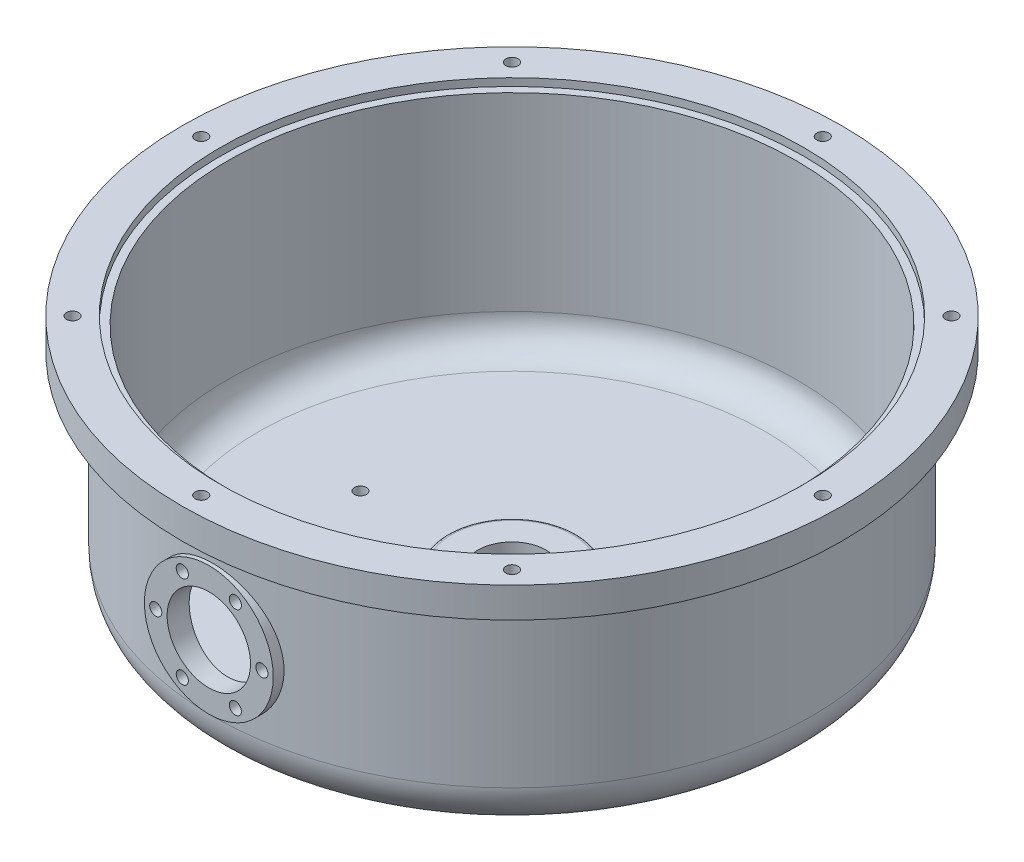
from build123d import *
from build123d.topology import SkipClean

# Parameters (mm, degrees)
FILLET1_R                            = 5
FILLET2_R                            = 60
FILLET3_R                            = 40
SKETCH2_R                            = 85
SKETCH2_R_2                          = 55
BOSS_EXTRUDE1_DEPTH                  = 5
BOSS_EXTRUDE1_DIRECTION_2_REACH      = 992.215
BOSS_EXTRUDE1_DIRECTION_2_END_RADIUS = 395
SKETCH3_R                            = 55
CUT_EXTRUDE1_DEPTH                   = 64
SKETCH4_R                            = 8
CUT_EXTRUDE2_DEPTH                   = 15
CUT_EXTRUDE3_DEPTH                   = 696.754985609
CUT_EXTRUDE3_DEPTH_BACK              = 696.754985609
SKETCH5_R                            = 8
SKETCH6_R                            = 8
CUT_EXTRUDE4_DEPTH                   = 20
SKETCH7_R                            = 8
CUT_EXTRUDE5_DEPTH                   = 20


with BuildPart() as part:
    # Sketch1 → Revolve1 (revolve)
    with BuildSketch(Plane.XY, mode=Mode.PRIVATE) as revolve1_sk:
        Polygon((-435, 320), (-385, 320), (-385, 310), (-375, 310), (-375, 20), (-85, 20), (-85, 30), (-45, 30), (-45, -5), (-85, -5), (-85, 0), (-395, 0), (-395, 280), (-435, 280), align=None)
    revolve(revolve1_sk.sketch.rotate(Axis((0, 0, 0), (0, 1, 0)), 270), axis=Axis((0, 0, 0), (0, 1, 0)))

    # Fillet1
    fillet1_edges = [part.edges().sort_by_distance(p)[0] for p in [
        (0, 0, 85),
        (0, 30, 85),
        (0, 20, 85),
    ]]
    fillet(fillet1_edges, radius=FILLET1_R - 0.0001)  # a hair under: the kernel refuses the full size

    # Fillet2
    fillet2_edges = [part.edges().sort_by_distance(p)[0] for p in [
        (0, 0, 395),
    ]]
    fillet(fillet2_edges, radius=FILLET2_R)

    # Fillet3
    fillet3_edges = [part.edges().sort_by_distance(p)[0] for p in [
        (0, 20, 375),
    ]]
    fillet(fillet3_edges, radius=FILLET3_R)

    # Sketch2 → Boss-Extrude1 (add)
    with BuildSketch(Plane.XY.offset(395)):
        with Locations(Location((0, 150, 0), (0, 0, 180))):
            Circle(SKETCH2_R)
        with Locations((0, 150)):
            Circle(SKETCH2_R_2, mode=Mode.SUBTRACT)
    extrude(amount=BOSS_EXTRUDE1_DEPTH)

    # Boss-Extrude1 direction 2: up to this cylinder (the profile starts outside it)
    with SkipClean():  # the faces are left unmerged after this step: merging them gives an invalid solid
        boss_extrude1_direction_2_end = Plane(origin=(0, 150, 0), z_dir=(0, -1, 0)) * Cylinder(BOSS_EXTRUDE1_DIRECTION_2_END_RADIUS, 2775.43, mode=Mode.PRIVATE)
        # Sketch2 → Boss-Extrude1 direction 2 (add, up to the surface)
        with BuildSketch(Plane.XY.offset(395), mode=Mode.PRIVATE) as boss_extrude1_direction_2_sk1:
            with Locations(Location((0, 150, 0), (0, 0, 180))):
                Circle(SKETCH2_R)
            with Locations((0, 150)):
                Circle(SKETCH2_R_2, mode=Mode.SUBTRACT)
        boss_extrude1_direction_2_tool1 = extrude(boss_extrude1_direction_2_sk1.sketch, amount=-BOSS_EXTRUDE1_DIRECTION_2_REACH, mode=Mode.PRIVATE) - boss_extrude1_direction_2_end
        add(boss_extrude1_direction_2_tool1.solids().sort_by_distance((82.595837, 150, 395))[0])
        add(boss_extrude1_direction_2_tool1.solids().sort_by_distance((82.595837, 150, 395))[1])

    # Sketch3 → Cut-Extrude1 (cut)
    with BuildSketch(Plane.XY.offset(400)):
        with Locations((0, 150)):
            Circle(SKETCH3_R)
    extrude(amount=-CUT_EXTRUDE1_DEPTH, mode=Mode.SUBTRACT)

    # Sketch4 → Cut-Extrude2 (cut)
    with BuildSketch(Plane.XY.offset(400)):
        with Locations((70, 150)):
            Circle(SKETCH4_R)
        with Locations((35, 89.378221735)):
            Circle(SKETCH4_R)
        with Locations((-35, 89.378221735)):
            Circle(SKETCH4_R)
        with Locations((-70, 150)):
            Circle(SKETCH4_R)
        with Locations((-35, 210.621778265)):
            Circle(SKETCH4_R)
        with Locations((35, 210.621778265)):
            Circle(SKETCH4_R)
    extrude(amount=-CUT_EXTRUDE2_DEPTH, mode=Mode.SUBTRACT)

    # Sketch5 → Cut-Extrude3 (cut, two sides: drawn at the far end of the back side and taken through both)
    with BuildSketch(Plane(origin=(0, 320, 0), x_dir=(1, 0, 0), z_dir=(0, 1, 0)).offset(-CUT_EXTRUDE3_DEPTH_BACK)):
        with Locations(Location((410, 0, 0), (0, 0, 270))):
            Circle(SKETCH5_R)
        with Locations(Location((289.913780286, -289.913780286, 0), (0, 0, 270))):
            Circle(SKETCH5_R)
        with Locations(Location((0, -410, 0), (0, 0, 270))):
            Circle(SKETCH5_R)
        with Locations(Location((-289.913780286, -289.913780286, 0), (0, 0, 270))):
            Circle(SKETCH5_R)
        with Locations(Location((-410, 0, 0), (0, 0, 270))):
            Circle(SKETCH5_R)
        with Locations(Location((-289.913780286, 289.913780286, 0), (0, 0, 270))):
            Circle(SKETCH5_R)
        with Locations(Location((0, 410, 0), (0, 0, 270))):
            Circle(SKETCH5_R)
        with Locations(Location((289.913780286, 289.913780286, 0), (0, 0, 270))):
            Circle(SKETCH5_R)
    extrude(amount=CUT_EXTRUDE3_DEPTH + CUT_EXTRUDE3_DEPTH_BACK, mode=Mode.SUBTRACT)

    # Sketch6 → Cut-Extrude4 (cut)
    with BuildSketch(Plane.XZ.offset(5)):
        with Locations(Location((70, 0, 0), (0, 0, 270))):
            Circle(SKETCH6_R)
        with Locations(Location((35, -60.621778265, 0), (0, 0, 270))):
            Circle(SKETCH6_R)
        with Locations(Location((-35, -60.621778265, 0), (0, 0, 270))):
            Circle(SKETCH6_R)
        with Locations(Location((-70, 0, 0), (0, 0, 270))):
            Circle(SKETCH6_R)
        with Locations(Location((-35, 60.621778265, 0), (0, 0, 270))):
            Circle(SKETCH6_R)
        with Locations(Location((35, 60.621778265, 0), (0, 0, 270))):
            Circle(SKETCH6_R)
    extrude(amount=-CUT_EXTRUDE4_DEPTH, mode=Mode.SUBTRACT)

    # Sketch7 → Cut-Extrude5 (cut)
    with BuildSketch(Plane.XZ):
        with Locations(Location((-200, 0, 0), (0, 0, 270))):
            Circle(SKETCH7_R)
    extrude(amount=-CUT_EXTRUDE5_DEPTH, mode=Mode.SUBTRACT)


solid = part.part
